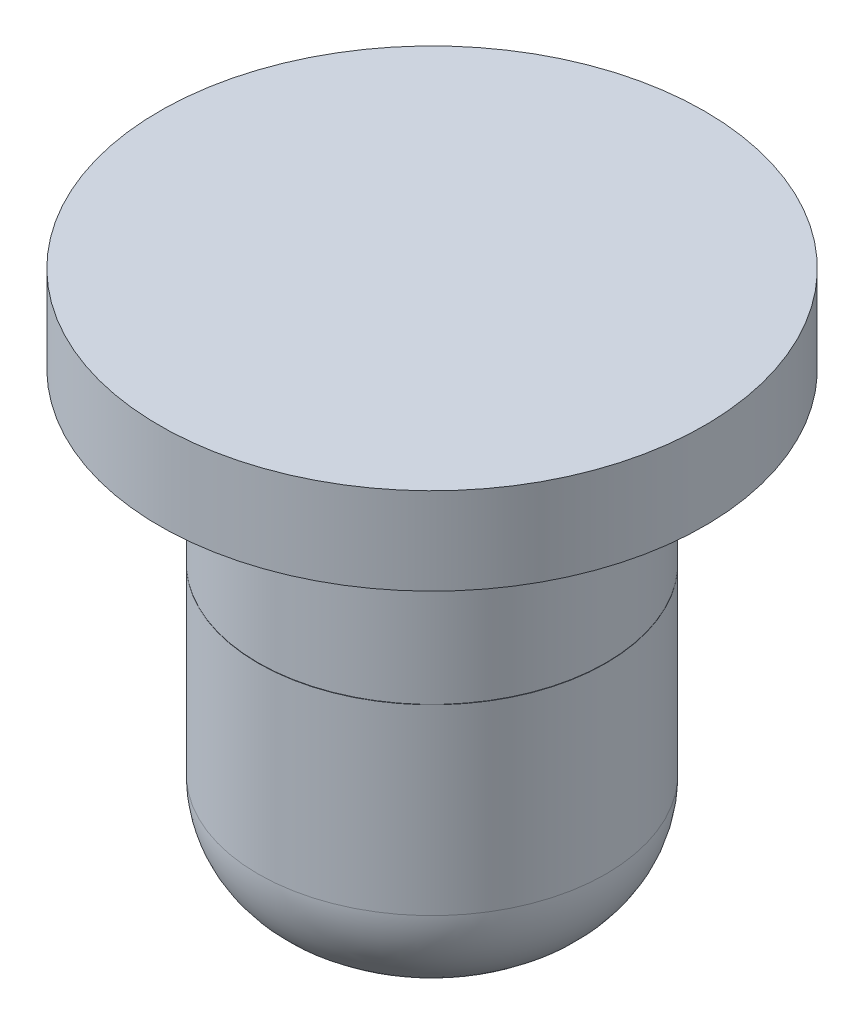
from build123d import *

# Parameters (mm, degrees)
CUT_EXTRUDE1_DEPTH      = 36.083710153
CUT_EXTRUDE1_DEPTH_BACK = 36.083710153
SKETCH2_W               = 72.831256038
SKETCH2_H               = 0.0254


with BuildPart() as part:
    # Sketch1 → Revolve1 (revolve)
    with BuildSketch(Plane.XY):
        with BuildLine():
            Line((0, 18.626666667), (19.896666667, 18.626666667))
            Line((19.896666667, 18.626666667), (19.896666667, 12.276666667))
            Line((19.896666667, 12.276666667), (12.7, 12.276666667))
            Line((12.7, 12.276666667), (12.7, -13.335))
            ThreePointArc((12.7, -13.335), (10.468153673, -18.723153673), (5.08, -20.955))
            Line((5.08, -20.955), (0, -20.955))
            Line((0, -20.955), (0, 18.626666667))
        make_face()
    revolve(axis=Axis((0, -20.955, 0), (0, 1, 0)))

    # Sketch2 → Cut-Extrude1 (cut, two sides: drawn at the far end of the back side and taken through both)
    with BuildSketch(Plane.XY.offset(-CUT_EXTRUDE1_DEPTH_BACK)):
        with Locations((0, 0.0127)):
            Rectangle(SKETCH2_W, SKETCH2_H)
    extrude(amount=CUT_EXTRUDE1_DEPTH + CUT_EXTRUDE1_DEPTH_BACK, mode=Mode.SUBTRACT)


with BuildPart() as cut_extrude1_piece_1:
    # of the separate pieces the step leaves, piece 1, a body of its own (cut_extrude1_pieces)
    add(part.part.solids().sort_by_distance((12.7, 12.276666667, 0))[0])


with BuildPart() as cut_extrude1_piece_2:
    # of the separate pieces the step leaves, piece 2, a body of its own (cut_extrude1_pieces)
    add(part.part.solids().sort_by_distance((5.08, -20.955, 0))[0])


solid = Compound([cut_extrude1_piece_1.part, cut_extrude1_piece_2.part])
